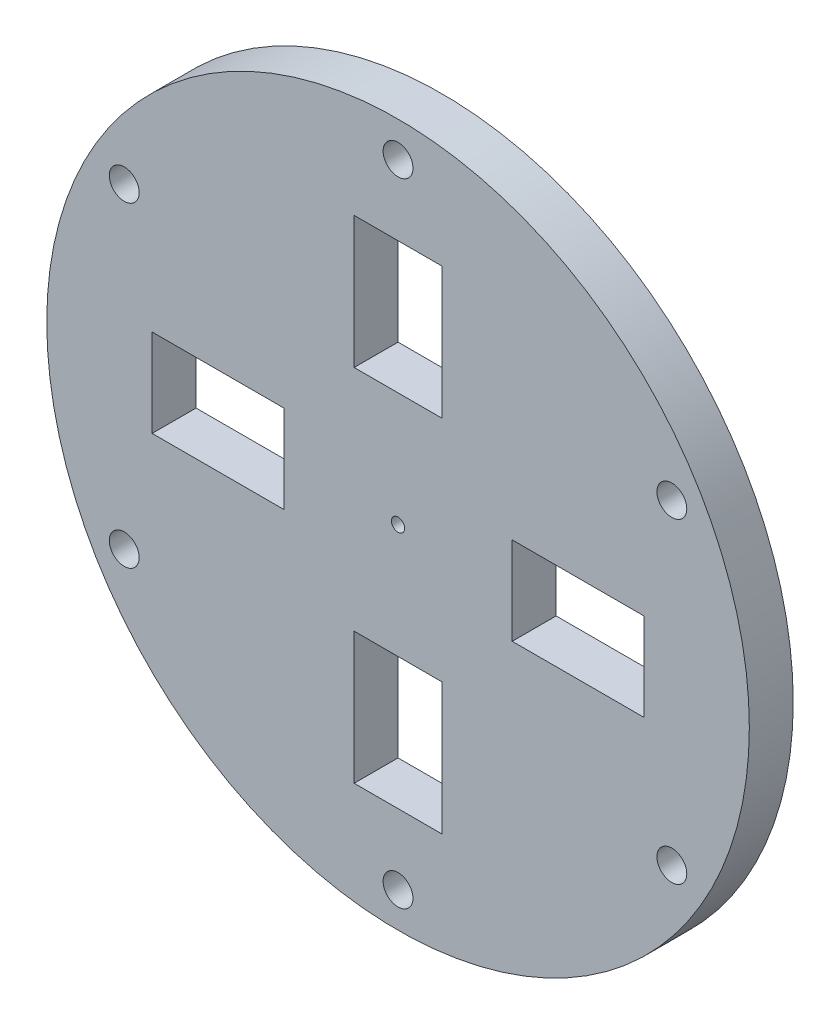
from build123d import *

# Parameters (mm, degrees)
SKETCH1_R           = 40
SKETCH1_R_2         = 0.75
BOSS_EXTRUDE1_DEPTH = 5
SKETCH4_W           = 10
SKETCH4_H           = 15
SKETCH4_W_2         = 15
SKETCH4_H_2         = 10
CUT_EXTRUDE3_DEPTH  = 57.789083458
SKETCH5_R           = 1.7
CUT_EXTRUDE4_DEPTH  = 57.789083458


with BuildPart() as part:
    # Sketch1 → Boss-Extrude1 (new body)
    with BuildSketch(Plane.XY):
        Circle(SKETCH1_R)
        Circle(SKETCH1_R_2, mode=Mode.SUBTRACT)
    extrude(amount=BOSS_EXTRUDE1_DEPTH)

    # Sketch4 → Cut-Extrude3 (cut, through all)
    with BuildSketch(Plane.XY.offset(5)):
        with Locations((0, 20.5)):
            Rectangle(SKETCH4_W, SKETCH4_H)
        with Locations((20.5, 0)):
            Rectangle(SKETCH4_W_2, SKETCH4_H_2)
        with Locations((0, -20.5)):
            Rectangle(SKETCH4_W, SKETCH4_H)
        with Locations((-20.5, 0)):
            Rectangle(SKETCH4_W_2, SKETCH4_H_2)
    extrude(amount=-CUT_EXTRUDE3_DEPTH, mode=Mode.SUBTRACT)

    # Sketch5 → Cut-Extrude4 (cut, through all)
    with BuildSketch(Plane.XY.offset(5)):
        with Locations((0, 36)):
            Circle(SKETCH5_R)
        with Locations((31.176914536, 18)):
            Circle(SKETCH5_R)
        with Locations((31.176914536, -18)):
            Circle(SKETCH5_R)
        with Locations((0, -36)):
            Circle(SKETCH5_R)
        with Locations((-31.176914536, -18)):
            Circle(SKETCH5_R)
        with Locations((-31.176914536, 18)):
            Circle(SKETCH5_R)
    extrude(amount=-CUT_EXTRUDE4_DEPTH, mode=Mode.SUBTRACT)


solid = part.part
